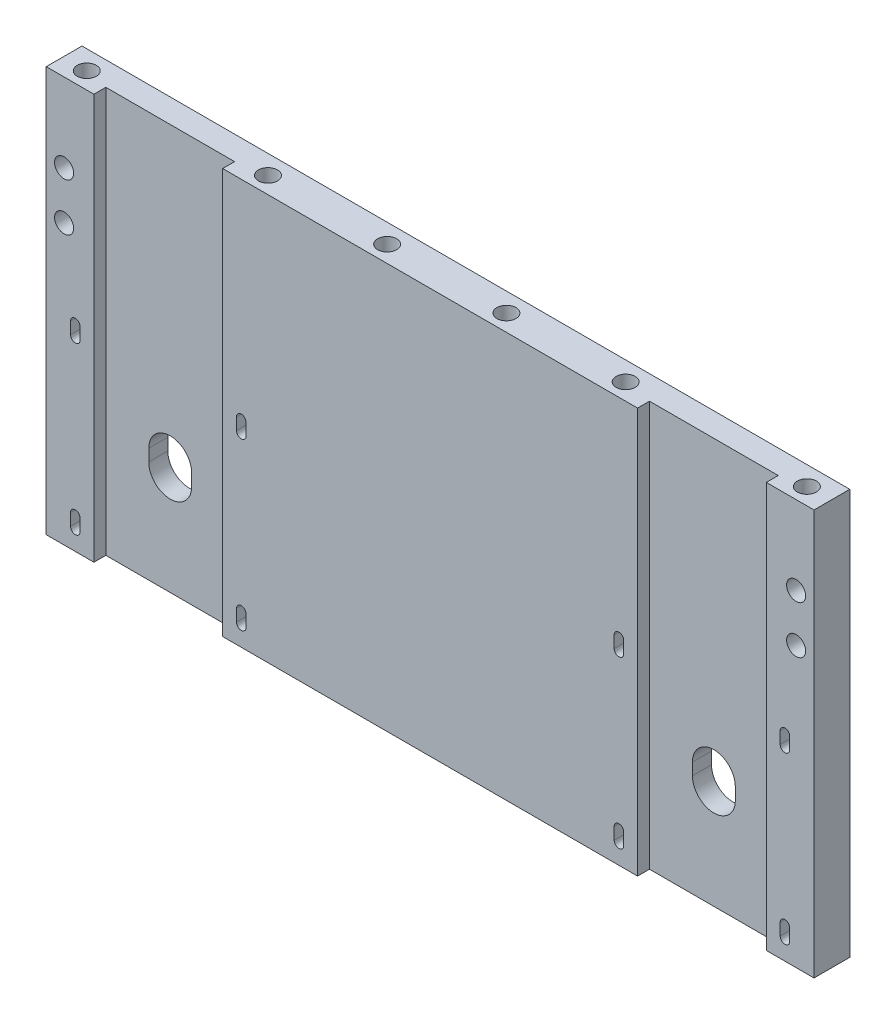
from build123d import *

# Parameters (mm, degrees)
SZKIC1_W                    = 322
SZKIC1_H                    = 170
DODANIE_WYCI_GNI_CIE1_DEPTH = 15
SZKIC3_W                    = 54
SZKIC3_H                    = 170
WYTNIJ_WYCI_GNI_CIE1_DEPTH  = 5
WYTNIJ_WYCI_GNI_CIE2_DEPTH  = 17.75
SZYK_LINIOWY1_COUNT         = 2
SZYK_LINIOWY1_PITCH         = 69.6
SZYK_LINIOWY1_COUNT_DIR2    = 2
SZYK_LINIOWY1_PITCH_DIR2    = 69.6
WYTNIJ_WYCI_GNI_CIE3_DEPTH  = 2
WYTNIJ_WYCI_GNI_CIE4_DEPTH  = 17.75
SZYK_LINIOWY2_COUNT         = 2
SZYK_LINIOWY2_PITCH         = 228
SZYK_LINIOWY2_COPY_1_DEPTH  = 17.75
SZYK_LINIOWY2_COPY_2_DEPTH  = 17.75
SZYK_LINIOWY2_COPY_3_DEPTH  = 17.75
SZKIC8_R                    = 4
WYTNIJ_WYCI_GNI_CIE5_DEPTH  = 20
SZKIC9_R                    = 4
WYTNIJ_WYCI_GNI_CIE6_DEPTH  = 20
SZYK_LINIOWY3_COUNT         = 4
SZYK_LINIOWY3_PITCH         = 50
SZKIC10_R                   = 4
WYTNIJ_WYCI_GNI_CIE7_DEPTH  = 20
SZKIC11_R                   = 4
WYTNIJ_WYCI_GNI_CIE8_DEPTH  = 20


with BuildPart() as part:
    # Szkic1 → Dodanie-wyciągnięcie1 (new body)
    with BuildSketch(Plane.XY):
        Rectangle(SZKIC1_W, SZKIC1_H)
    extrude(amount=DODANIE_WYCI_GNI_CIE1_DEPTH)

    # Szkic3 → Wytnij-wyciągnięcie1 (cut)
    with BuildSketch(Plane.XY.offset(15)):
        with Locations((-114, 0)):
            Rectangle(SZKIC3_W, SZKIC3_H)
        with Locations((114, 0)):
            Rectangle(SZKIC3_W, SZKIC3_H)
    extrude(amount=-WYTNIJ_WYCI_GNI_CIE1_DEPTH, mode=Mode.SUBTRACT)

    # Szkic2 → Wytnij-wyciągnięcie2 (cut)
    with BuildSketch(Plane.XY.offset(15)):
        with BuildLine():
            ThreePointArc((-146.8, -71.87), (-148.8, -69.87), (-150.8, -71.87))
            Line((-150.8, -71.87), (-150.8, -76.87))
            ThreePointArc((-150.8, -76.87), (-148.8, -78.87), (-146.8, -76.87))
            Line((-146.8, -76.87), (-146.8, -71.87))
        make_face()
    wytnij_wyci_gni_cie2 = extrude(amount=-WYTNIJ_WYCI_GNI_CIE2_DEPTH, mode=Mode.SUBTRACT)

    # Szyk liniowy1: Wytnij-wyci_gni_cie2 2 × 2
    with Locations(*[(i * SZYK_LINIOWY1_PITCH, j * SZYK_LINIOWY1_PITCH_DIR2, 0) for i in range(SZYK_LINIOWY1_COUNT) for j in range(SZYK_LINIOWY1_COUNT_DIR2) if (i, j) != (0, 0)]):
        add(wytnij_wyci_gni_cie2, mode=Mode.SUBTRACT)

    # Szkic5 → Wytnij-wyciągnięcie3 (cut)
    with BuildSketch(Plane(origin=(0, 0, 0), x_dir=(-1, 0, 0), z_dir=(0, 0, -1))):
        with BuildLine():
            ThreePointArc((77.5, -42.07), (114, -78.57), (150.5, -42.07))
            Line((150.5, -42.07), (150.5, -37.07))
            ThreePointArc((150.5, -37.07), (114, -0.57), (77.5, -37.07))
            Line((77.5, -37.07), (77.5, -42.07))
        make_face()
    wytnij_wyci_gni_cie3 = extrude(amount=-WYTNIJ_WYCI_GNI_CIE3_DEPTH, mode=Mode.SUBTRACT)

    # Szkic7 → Wytnij-wyciągnięcie4 (cut)
    with BuildSketch(Plane(origin=(0, 0, 2), x_dir=(-1, 0, 0), z_dir=(0, 0, -1))):
        with BuildLine():
            ThreePointArc((123, -37.07), (114, -28.07), (105, -37.07))
            Line((105, -37.07), (105, -42.07))
            ThreePointArc((105, -42.07), (114, -51.07), (123, -42.07))
            Line((123, -42.07), (123, -37.07))
        make_face()
    wytnij_wyci_gni_cie4 = extrude(amount=-WYTNIJ_WYCI_GNI_CIE4_DEPTH, mode=Mode.SUBTRACT)

    # Szyk liniowy2: Wytnij-wyciągnięcie2, Wytnij-wyciągnięcie3, Wytnij-wyciągnięcie4 ×2
    with Locations(*[(i * SZYK_LINIOWY2_PITCH, 0, 0) for i in range(1, SZYK_LINIOWY2_COUNT)]):
        add(wytnij_wyci_gni_cie2, mode=Mode.SUBTRACT)
        add(wytnij_wyci_gni_cie3, mode=Mode.SUBTRACT)
        add(wytnij_wyci_gni_cie4, mode=Mode.SUBTRACT)

    # Szyk liniowy2 copy 1 sketch → Szyk liniowy2 copy 1 (cut)
    with BuildSketch(Plane(origin=(228, 69.6, 15), x_dir=(1, 0, 0), z_dir=(0, 0, 1))):
        with BuildLine():
            ThreePointArc((-146.8, -71.87), (-148.8, -69.87), (-150.8, -71.87))
            Line((-150.8, -71.87), (-150.8, -76.87))
            ThreePointArc((-150.8, -76.87), (-148.8, -78.87), (-146.8, -76.87))
            Line((-146.8, -76.87), (-146.8, -71.87))
        make_face()
    extrude(amount=-SZYK_LINIOWY2_COPY_1_DEPTH, mode=Mode.SUBTRACT)

    # Szyk liniowy2 copy 2 sketch → Szyk liniowy2 copy 2 (cut)
    with BuildSketch(Plane(origin=(297.6, 0, 15), x_dir=(1, 0, 0), z_dir=(0, 0, 1))):
        with BuildLine():
            ThreePointArc((-146.8, -71.87), (-148.8, -69.87), (-150.8, -71.87))
            Line((-150.8, -71.87), (-150.8, -76.87))
            ThreePointArc((-150.8, -76.87), (-148.8, -78.87), (-146.8, -76.87))
            Line((-146.8, -76.87), (-146.8, -71.87))
        make_face()
    extrude(amount=-SZYK_LINIOWY2_COPY_2_DEPTH, mode=Mode.SUBTRACT)

    # Szyk liniowy2 copy 3 sketch → Szyk liniowy2 copy 3 (cut)
    with BuildSketch(Plane(origin=(297.6, 69.6, 15), x_dir=(1, 0, 0), z_dir=(0, 0, 1))):
        with BuildLine():
            ThreePointArc((-146.8, -71.87), (-148.8, -69.87), (-150.8, -71.87))
            Line((-150.8, -71.87), (-150.8, -76.87))
            ThreePointArc((-150.8, -76.87), (-148.8, -78.87), (-146.8, -76.87))
            Line((-146.8, -76.87), (-146.8, -71.87))
        make_face()
    extrude(amount=-SZYK_LINIOWY2_COPY_3_DEPTH, mode=Mode.SUBTRACT)

    # Szkic8 → Wytnij-wyciągnięcie5 (cut)
    with BuildSketch(Plane(origin=(0, 85, 0), x_dir=(1, 0, 0), z_dir=(0, 1, 0))):
        with Locations((-151, -8)):
            Circle(SZKIC8_R)
        with Locations((151, -8)):
            Circle(SZKIC8_R)
    extrude(amount=-WYTNIJ_WYCI_GNI_CIE5_DEPTH, mode=Mode.SUBTRACT)

    # Szkic9 → Wytnij-wyciągnięcie6 (cut)
    with BuildSketch(Plane(origin=(0, 85, 0), x_dir=(1, 0, 0), z_dir=(0, 1, 0))):
        with Locations((-75, -8)):
            Circle(SZKIC9_R)
    wytnij_wyci_gni_cie6 = extrude(amount=-WYTNIJ_WYCI_GNI_CIE6_DEPTH, mode=Mode.SUBTRACT)

    # Szyk liniowy3: Wytnij-wyciągnięcie6 ×4
    with Locations(*[(i * SZYK_LINIOWY3_PITCH, 0, 0) for i in range(1, SZYK_LINIOWY3_COUNT)]):
        add(wytnij_wyci_gni_cie6, mode=Mode.SUBTRACT)

    # Szkic10 → Wytnij-wyciągnięcie7 (cut)
    with BuildSketch(Plane.XY.offset(15)):
        with Locations((-153.5, 52)):
            Circle(SZKIC10_R)
        with Locations((-153.5, 32)):
            Circle(SZKIC10_R)
    extrude(amount=-WYTNIJ_WYCI_GNI_CIE7_DEPTH, mode=Mode.SUBTRACT)

    # Szkic11 → Wytnij-wyciągnięcie8 (cut)
    with BuildSketch(Plane.XY.offset(15)):
        with Locations((153.5, 32)):
            Circle(SZKIC11_R)
        with Locations((153.5, 52)):
            Circle(SZKIC11_R)
    extrude(amount=-WYTNIJ_WYCI_GNI_CIE8_DEPTH, mode=Mode.SUBTRACT)


solid = part.part
